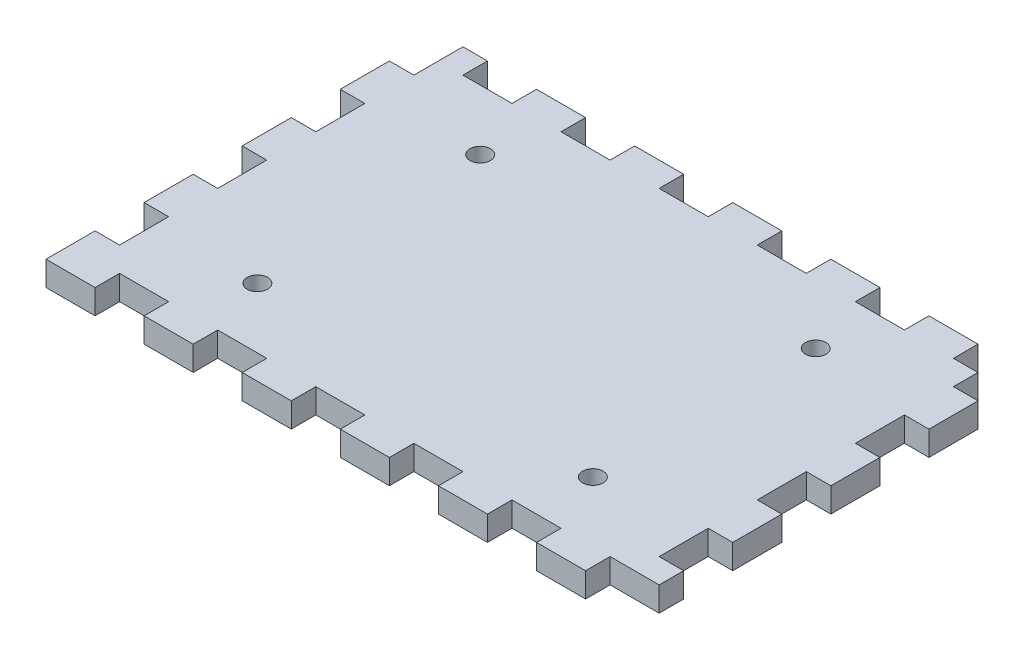
from build123d import *

# Parameters (mm, degrees)
SKETCH1_W             = 152.4
SKETCH1_H             = 101.6
BOSS_EXTRUDE2_DEPTH   = 6.35
SKETCH2_W             = 6.35
SKETCH2_H             = 12.7
CUT_EXTRUDE2_DEPTH    = 6.35
SKETCH2_4_W           = 12.7
SKETCH2_4_H           = 6.35
CUT_EXTRUDE3_DEPTH    = 6.35
F_5_0MM_DOWEL_HOLE7_D = 5.3


with BuildPart() as part:
    # Sketch1 → Boss-Extrude2 (new body)
    with BuildSketch(Plane(origin=(0, 0, 0), x_dir=(1, 0, 0), z_dir=(0, 1, 0))):
        with Locations((76.2, 50.8)):
            Rectangle(SKETCH1_W, SKETCH1_H)
    extrude(amount=BOSS_EXTRUDE2_DEPTH)

    # Sketch2 → Cut-Extrude2 (cut)
    with BuildSketch(Plane(origin=(0, 6.35, 0), x_dir=(1, 0, 0), z_dir=(0, 1, 0))):
        with Locations((3.175, 95.25)):
            Rectangle(SKETCH2_W, SKETCH2_H)
        with Locations((3.175, 69.85)):
            Rectangle(SKETCH2_W, SKETCH2_H)
        with Locations((3.175, 44.45)):
            Rectangle(SKETCH2_W, SKETCH2_H)
        with Locations((3.175, 19.05)):
            Rectangle(SKETCH2_W, SKETCH2_H)
    cut_extrude2 = extrude(amount=-CUT_EXTRUDE2_DEPTH, mode=Mode.SUBTRACT)

    # Mirror1: Cut-Extrude2 across plane
    add(cut_extrude2.mirror(Plane.ZY.offset(-76.2)), mode=Mode.SUBTRACT)

    # Sketch2<4> → Cut-Extrude3 (cut)
    with BuildSketch(Plane(origin=(0, 6.35, 0), x_dir=(1, 0, 0), z_dir=(0, 1, 0))):
        with Locations((19.05, 98.425)):
            Rectangle(SKETCH2_4_W, SKETCH2_4_H)
        with Locations((44.45, 98.425)):
            Rectangle(SKETCH2_4_W, SKETCH2_4_H)
        with Locations((69.85, 98.425)):
            Rectangle(SKETCH2_4_W, SKETCH2_4_H)
        with Locations((95.25, 98.425)):
            Rectangle(SKETCH2_4_W, SKETCH2_4_H)
        with Locations((146.05, 98.425)):
            Rectangle(SKETCH2_4_W, SKETCH2_4_H)
        with Locations((120.65, 98.425)):
            Rectangle(SKETCH2_4_W, SKETCH2_4_H)
    cut_extrude3 = extrude(amount=-CUT_EXTRUDE3_DEPTH, mode=Mode.SUBTRACT)

    # Mirror2: Cut-Extrude3 across plane
    add(cut_extrude3.mirror(Plane(origin=(0, 0, -50.8), x_dir=(1, 0, 0), z_dir=(0, 0, -1))), mode=Mode.SUBTRACT)

    # Ø5.0mm Dowel Hole7 (through all)
    with Locations(Plane(origin=(0, 0, 0), x_dir=(-1, 0, 0), z_dir=(0, -1, 0))):
        with Locations((-119.634, 79.65), (-32.766, 79.65), (-32.766, 21.95), (-119.634, 21.95)):
            Hole(F_5_0MM_DOWEL_HOLE7_D / 2)


solid = part.part
